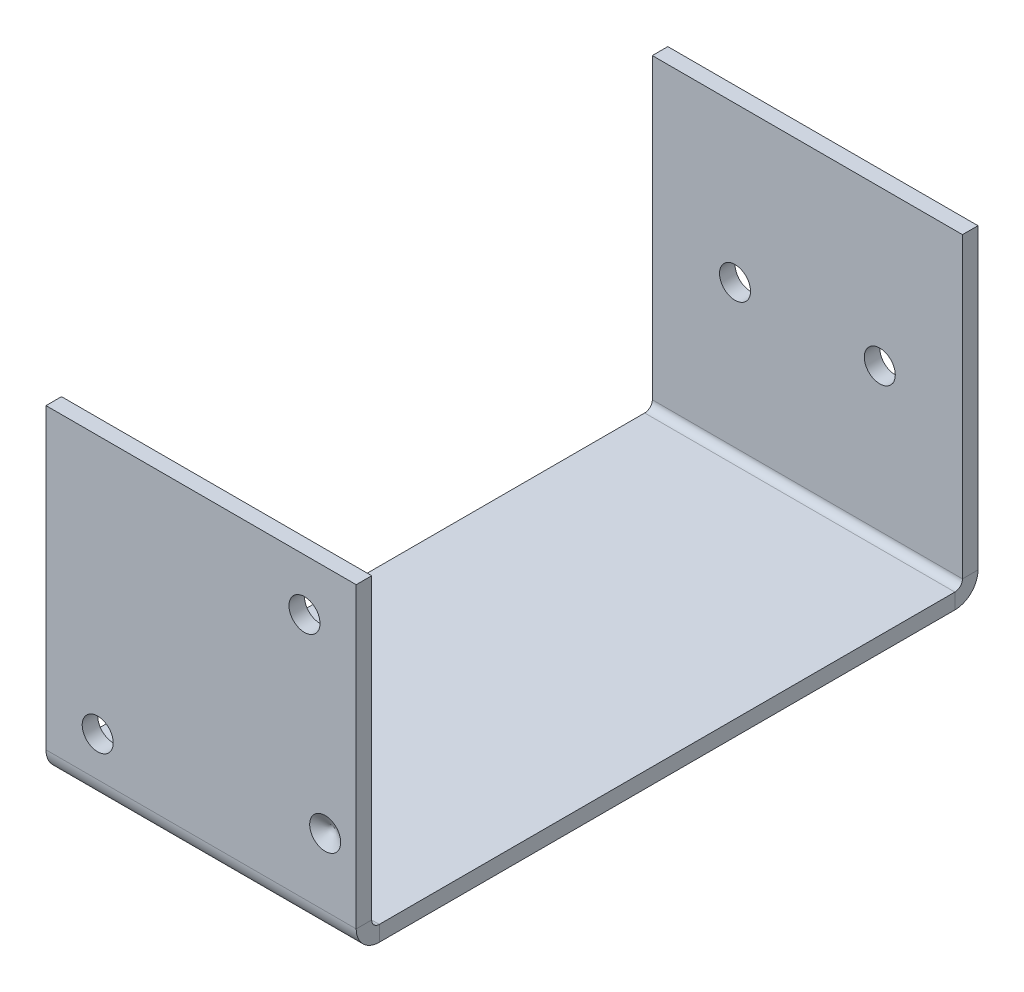
from build123d import *

# Parameters (mm, degrees)
SKETCH1_W                       = 30
SKETCH1_H                       = 118
SKETCH1_R                       = 1.5
BASE_FLANGE1_DEPTH              = 1.5
SKETCHED_BEND1_DEPTH            = 30
SKETCHED_BEND1_2_DEPTH          = 30
SKETCHED_START                  = -89.06902709
SKETCHED_BEND1_3_OUTLINE_R      = 1.5
SKETCHED_BEND1_3_DEPTH          = 1.5
SKETCHED_START_2                = -87.56902709
SKETCHED_BEND1_4_OUTLINE_R      = 1.5
SKETCHED_BEND1_4_DEPTH          = 59.56902709
F_3_0MM_PRESS_DOWEL_HOLE1_D     = 3
F_3_0MM_PRESS_DOWEL_HOLE1_DEPTH = 6
F_3_0MM_PRESS_DOWEL_HOLE1_TIP   = 0.901290929


with BuildPart() as part:
    # Base-Flange1: sheet metal written as solids
    # Sketch1 → Base-Flange1 (new body)
    with BuildSketch(Plane(origin=(0, 0, 0), x_dir=(1, 0, 0), z_dir=(0, 1, 0))):
        with Locations((15, 59)):
            Rectangle(SKETCH1_W, SKETCH1_H)
        with Locations(Location((8, 103, 0), (0, 0, 270))):
            Circle(SKETCH1_R, mode=Mode.SUBTRACT)
        with Locations(Location((22, 103, 0), (0, 0, 270))):
            Circle(SKETCH1_R, mode=Mode.SUBTRACT)
        with Locations(Location((25, 5, 0), (0, 0, 270))):
            Circle(SKETCH1_R, mode=Mode.SUBTRACT)
        with Locations(Location((5, 25, 0), (0, 0, 270))):
            Circle(SKETCH1_R, mode=Mode.SUBTRACT)
    extrude(amount=-BASE_FLANGE1_DEPTH)

    # Sketched Bend1: read off the stored shape, not the designer's step
    # Sketched Bend1 outline → Sketched Bend1 (cut)
    with BuildSketch(Plane.YZ):
        with BuildLine():
            ThreePointArc((0, -88.944250946), (-1.086838938, -88.127591172), (-1.5, -86.83242709))
            Line((-1.5, -86.83242709), (-1.5, -118))
            Line((-1.5, -118), (0, -118))
            Line((0, -118), (0, -88.944250946))
        make_face()
        with BuildLine():
            Line((-1.5, 0), (-1.5, -31.16757291))
            ThreePointArc((-1.5, -31.16757291), (-1.086838938, -29.872408828), (0, -29.055749054))
            Line((0, -29.055749054), (0, 0))
            Line((0, 0), (-1.5, 0))
        make_face()
    extrude(amount=SKETCHED_BEND1_DEPTH, mode=Mode.SUBTRACT)

    # Sketched Bend1 2 outline → Sketched Bend1 2 (add)
    with BuildSketch(Plane.YZ):
        with BuildLine():
            Line((0, -86.83242709), (0, -88.944250946))
            ThreePointArc((0, -88.944250946), (0.363053267, -89.037612433), (0.7366, -89.06902709))
            Line((0.7366, -89.06902709), (29.56902709, -89.06902709))
            Line((29.56902709, -89.06902709), (29.56902709, -87.56902709))
            Line((29.56902709, -87.56902709), (0.7366, -87.56902709))
            ThreePointArc((0.7366, -87.56902709), (0.215745145, -87.353281945), (0, -86.83242709))
        make_face()
        with BuildLine():
            ThreePointArc((0.7366, -28.93097291), (0.363053267, -28.962387567), (0, -29.055749054))
            Line((0, -29.055749054), (0, -31.16757291))
            ThreePointArc((0, -31.16757291), (0.215745145, -30.646718055), (0.7366, -30.43097291))
            Line((0.7366, -30.43097291), (29.56902709, -30.43097291))
            Line((29.56902709, -30.43097291), (29.56902709, -28.93097291))
            Line((29.56902709, -28.93097291), (0.7366, -28.93097291))
        make_face()
    extrude(amount=SKETCHED_BEND1_2_DEPTH)

    # Sketched Bend1 3 outline → Sketched Bend1 3 (cut)
    with BuildSketch(Plane.XY.offset(SKETCHED_START)):
        with Locations((8, 14.56902709)):
            Circle(SKETCHED_BEND1_3_OUTLINE_R)
        with Locations((22, 14.56902709)):
            Circle(SKETCHED_BEND1_3_OUTLINE_R)
    extrude(amount=SKETCHED_BEND1_3_DEPTH, mode=Mode.SUBTRACT)

    # Sketched Bend1 4 outline → Sketched Bend1 4 (cut)
    with BuildSketch(Plane.XY.offset(SKETCHED_START_2)):
        with Locations((5, 4.56902709)):
            Circle(SKETCHED_BEND1_4_OUTLINE_R)
        with Locations((25, 24.56902709)):
            Circle(SKETCHED_BEND1_4_OUTLINE_R)
    extrude(amount=SKETCHED_BEND1_4_DEPTH, mode=Mode.SUBTRACT)

    # Ø3.0mm Press Dowel Hole1
    with Locations(Plane(origin=(257.525513363, 325.031359221, -22.93097291), x_dir=(-1, 0, 0), z_dir=(0, 0, 1))):
        with Locations((220.525513363, 156.531359221), (102.525513363, 181.531359221), (102.525513363, 271.531359221), (89.19270005, 226.531359221), (210.525513363, 317.793651488), (230.525513363, 317.793651488), (252.525513363, 320.462332131), (232.525513363, 300.462332131), (252.525513363, 132.600386311), (232.525513363, 152.600386311), (111.286271896, 136.531359221), (91.286271896, 136.531359221), (41.525513363, 196.432813402), (13.525513363, 196.432813402), (41.525513363, 138.767959221), (13.525513363, 138.767959221), (41.525513363, 256.62990504), (13.525513363, 256.62990504), (41.525513363, 314.294759221), (13.525513363, 314.294759221)):
            Hole(F_3_0MM_PRESS_DOWEL_HOLE1_D / 2, depth=F_3_0MM_PRESS_DOWEL_HOLE1_DEPTH)
            with Locations((0, 0, -(F_3_0MM_PRESS_DOWEL_HOLE1_DEPTH + F_3_0MM_PRESS_DOWEL_HOLE1_TIP / 2))):  # 118° drill point
                Cone(0, F_3_0MM_PRESS_DOWEL_HOLE1_D / 2, F_3_0MM_PRESS_DOWEL_HOLE1_TIP, mode=Mode.SUBTRACT)


solid = part.part
